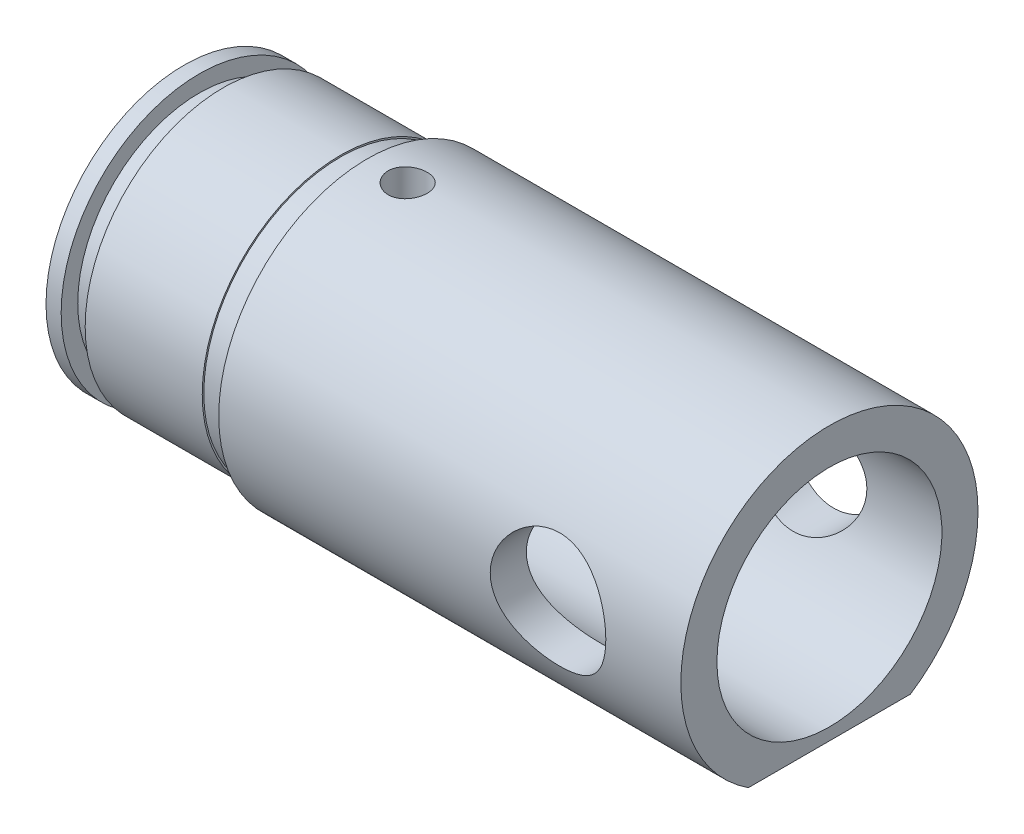
from build123d import *

# Parameters (mm, degrees)
CUT_EXTRUDE4_DEPTH      = 33.584101691
CUT_EXTRUDE4_DEPTH_BACK = 33.584101691
CUT_EXTRUDE5_DEPTH      = 33.584101691
CUT_EXTRUDE5_DEPTH_BACK = 33.584101691
SKETCH4_R               = 1.651
CUT_EXTRUDE6_DEPTH      = 4.572
CUT_EXTRUDE7_DEPTH      = 33.584101852
CUT_EXTRUDE7_DEPTH_BACK = 33.584101852
SKETCH5_R               = 4.8895


with BuildPart() as part:
    # Sketch1 → Revolve2 (revolve)
    with BuildSketch(Plane.XY):
        Polygon((-8.1915, 2.413), (-23.9903, 2.413), (-23.9903, 0), (-27.305, 0), (-27.305, 11.684), (-26.0223, 11.684), (-26.0223, 10.28065), (-23.9903, 10.28065), (-23.9903, 11.684), (-14.0843, 11.684), (-14.0843, 11.55065), (-11.7983, 11.55065), (-11.7983, 12.573), (27.305, 12.573), (27.305, 9.51865), (-4.5466, 9.51865), align=None)
    revolve(axis=Axis((-164.248525739, 0, 0), (1, 0, 0)))

    # Sketch2 → Cut-Extrude4 (cut, two sides: drawn at the far end of the back side and taken through both)
    with BuildSketch(Plane.XY.offset(-CUT_EXTRUDE4_DEPTH_BACK)):
        Polygon((-9.2583, -111.324252901), (-9.2583, -12.573), (-9.2583, -10.795), (2.4257, -10.795), (2.4257, -12.573), (2.4257, -111.324252901), (2.4257, -308.826758704), (-9.2583, -308.826758704), align=None)
    extrude(amount=CUT_EXTRUDE4_DEPTH + CUT_EXTRUDE4_DEPTH_BACK, mode=Mode.SUBTRACT)

    # Sketch3 → Cut-Extrude5 (cut, two sides: drawn at the far end of the back side and taken through both)
    with BuildSketch(Plane.XY.offset(-CUT_EXTRUDE5_DEPTH_BACK)):
        Polygon((-110.568420787, -38.115684157), (17.145, -12.573), (27.305, -10.541), (27.305, -12.573), (27.305, -142.815644948), (-130.230317192, -350.264940172), (-268.103737979, -245.564979382), align=None)
    extrude(amount=CUT_EXTRUDE5_DEPTH + CUT_EXTRUDE5_DEPTH_BACK, mode=Mode.SUBTRACT)

    # Sketch4 → Cut-Extrude6 (cut)
    with BuildSketch(Plane(origin=(0, 12.573, 0), x_dir=(-1, 0, 0), z_dir=(0, 1, 0))):
        with Locations((8.382, 0)):
            Circle(SKETCH4_R)
    extrude(amount=-CUT_EXTRUDE6_DEPTH, mode=Mode.SUBTRACT)

    # Sketch5 → Cut-Extrude7 (cut, two sides: drawn at the far end of the back side and taken through both)
    with BuildSketch(Plane.XY.offset(-CUT_EXTRUDE7_DEPTH_BACK)):
        with Locations((16.0655, 0)):
            Circle(SKETCH5_R)
    extrude(amount=CUT_EXTRUDE7_DEPTH + CUT_EXTRUDE7_DEPTH_BACK, mode=Mode.SUBTRACT)


solid = part.part
